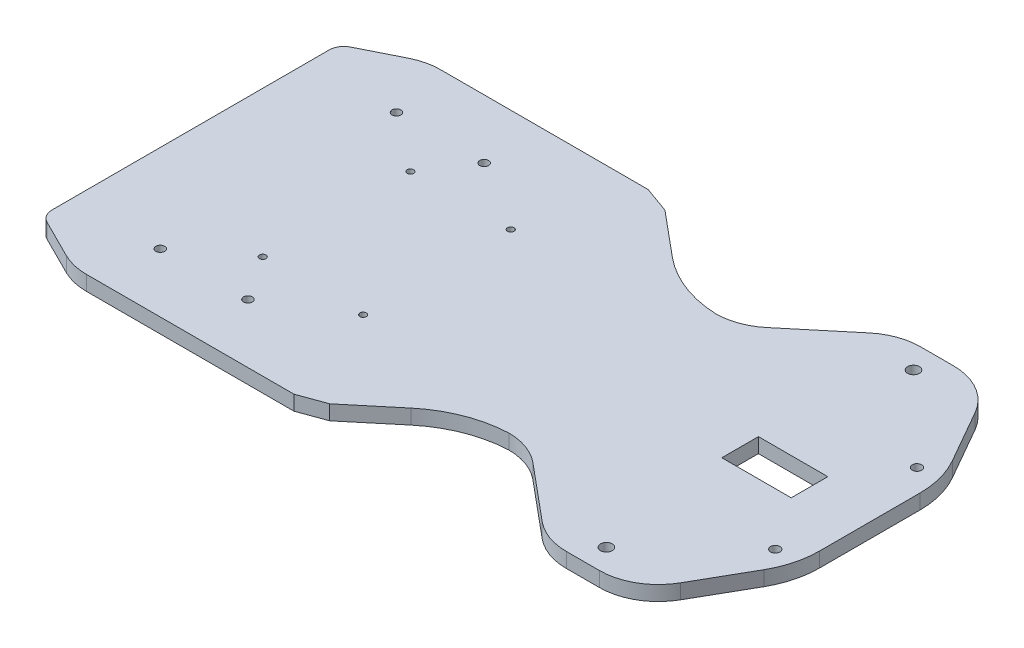
from build123d import *
from OCP.BRepFilletAPI import BRepFilletAPI_MakeChamfer

# Parameters (mm, degrees)
BOSS_EXTRUDE1_DEPTH   = 5
CHAMFER1_SIZE         = 5
CHAMFER1_SIZE2        = 5.047084744
FILLET4_R             = 20
F_4_0MM_DOWEL_HOLE1_D = 4
SKETCH5_R             = 2.75
CUT_EXTRUDE1_DEPTH    = 2
FILLET5_R             = 30
FILLET6_R             = 20
FILLET7_R             = 40
FILLET8_R             = 20
FILLET9_R             = 5
CUT_EXTRUDE3_REACH    = 154.398
SKETCH7_R             = 1.5
CUT_EXTRUDE4_REACH    = 154.398
SKETCH8_W             = 23.5
SKETCH8_H             = 12.4
CUT_EXTRUDE5_REACH    = 154.398
SKETCH9_R             = 1.1
CUT_EXTRUDE6_REACH    = 154.398
SKETCH11_R            = 1.6


with BuildPart() as part:
    # Sketch1 → Boss-Extrude1 (new body)
    with BuildSketch(Plane(origin=(0, 0, 0), x_dir=(1, 0, 0), z_dir=(0, 1, 0))):
        Polygon((40, 60), (70, 60), (90, 25), (90, -25), (70, -60), (40, -60), (10, -35), (-10, -35), (-40, -60), (-120, -60), (-140, -50), (-140, 50), (-120, 60), (-40, 60), (-10, 35), (10, 35), align=None)
    extrude(amount=BOSS_EXTRUDE1_DEPTH)

    # Chamfer1: one chamfer whose edges measure the first distance from different faces: ONE call of the kernel's chamfer builder (chamfer() names one face for all edges)
    chamfer1_edges_1 = [part.edges().sort_by_distance(p)[0] for p in [
        (-40, 2.5, 60),
    ]]
    chamfer1_side_1 = [part.faces().sort_by_distance(p)[0] for p in [
        (-80, 2.5, 60),
    ]]
    chamfer1_edges_2 = [part.edges().sort_by_distance(p)[0] for p in [
        (-40, 2.5, -60),
    ]]
    chamfer1_side_2 = [part.faces().sort_by_distance(p)[0] for p in [
        (-25, 2.5, -47.5),
    ]]
    chamfer1 = BRepFilletAPI_MakeChamfer(part.part.solid().wrapped)
    for e in chamfer1_edges_1:
        chamfer1.Add(CHAMFER1_SIZE, CHAMFER1_SIZE2, e.wrapped, chamfer1_side_1[0].wrapped)  # the first distance lies on this face
    for e in chamfer1_edges_2:
        chamfer1.Add(CHAMFER1_SIZE, CHAMFER1_SIZE2, e.wrapped, chamfer1_side_2[0].wrapped)  # the first distance lies on this face
    add(Compound.cast(chamfer1.Shape()), mode=Mode.REPLACE)

    # Fillet4
    fillet4_edges = [part.edges().sort_by_distance(p)[0] for p in [
        (40, 2.5, -60),
        (70, 2.5, -60),
        (70, 2.5, 60),
        (40, 2.5, 60),
    ]]
    fillet(fillet4_edges, radius=FILLET4_R)

    # Ø4.0mm Dowel Hole1 (through all)
    with Locations(Plane(origin=(52.817273997, 5, -52), x_dir=(0, 0, 1), z_dir=(0, 1, 0))):
        with Locations((0, 0), (104, 0)):
            Hole(F_4_0MM_DOWEL_HOLE1_D / 2)

    # Sketch5 → Cut-Extrude1 (cut)
    with BuildSketch(Plane.XZ):
        with Locations(Location((52.817273997, 52, 0), (0, 0, 270))):
            Circle(SKETCH5_R)
        with Locations(Location((52.817273997, -52, 0), (0, 0, 270))):
            Circle(SKETCH5_R)
    extrude(amount=-CUT_EXTRUDE1_DEPTH, mode=Mode.SUBTRACT)

    # Fillet5
    fillet5_edges = [part.edges().sort_by_distance(p)[0] for p in [
        (90, 2.5, -25),
        (90, 2.5, 25),
    ]]
    fillet(fillet5_edges, radius=FILLET5_R)

    # Fillet6
    fillet6_edges = [part.edges().sort_by_distance(p)[0] for p in [
        (10, 2.5, 35),
        (10, 2.5, -35),
    ]]
    fillet(fillet6_edges, radius=FILLET6_R)

    # Fillet7
    # the kernel refuses this fillet: 40 mm, written as the material it adds along each edge
    with BuildSketch(Plane(origin=(-10, 0, -35), x_dir=(-0.768221279597376, 0, -0.6401843996644798), z_dir=(0, 1, 0))) as fillet7_piece_1:
        with BuildLine():
            CenterArc((14.420794682, -40), FILLET7_R, 90, 37.26938559)
            Line((-9.801736302, -8.168113585), (0, 0))
            Line((0, 0), (14.420794682, 0))
        make_face()
    extrude(amount=5)
    with BuildSketch(Plane(origin=(-10, 0, 35), x_dir=(1, 0, 0), z_dir=(0, 1, 0))) as fillet7_piece_2:
        with BuildLine():
            CenterArc((14.529014643, -39.96081897), FILLET7_R, 92.536185502, 37.26938559)
            Line((-11.078361343, -9.231967786), (0, 0))
            Line((0, 0), (12.759001296, 0))
        make_face()
    extrude(amount=5)

    # Fillet8
    fillet8_edges = [part.edges().sort_by_distance(p)[0] for p in [
        (-120, 2.5, 60),
        (-120, 2.5, -60),
    ]]
    fillet(fillet8_edges, radius=FILLET8_R)

    # Fillet9
    fillet9_edges = [part.edges().sort_by_distance(p)[0] for p in [
        (-140, 2.5, 50),
        (-140, 2.5, -50),
    ]]
    fillet(fillet9_edges, radius=FILLET9_R)

    # Sketch7 → Cut-Extrude3 (cut, up to next)
    with BuildSketch(Plane(origin=(0, 5, 0), x_dir=(1, 0, 0), z_dir=(0, 1, 0)), mode=Mode.PRIVATE) as cut_extrude3_sk1:
        with Locations(Location((-110.27864045, 40, 0), (0, 0, 270))):
            Circle(SKETCH7_R)
    cut_extrude3_tool1 = extrude(cut_extrude3_sk1.sketch, amount=-CUT_EXTRUDE3_REACH, mode=Mode.PRIVATE) & part.part
    # Sketch7 → Cut-Extrude3 (cut, up to next)
    with BuildSketch(Plane(origin=(0, 5, 0), x_dir=(1, 0, 0), z_dir=(0, 1, 0)), mode=Mode.PRIVATE) as cut_extrude3_sk2:
        with Locations(Location((-80.57864045, 40, 0), (0, 0, 270))):
            Circle(SKETCH7_R)
    cut_extrude3_tool2 = extrude(cut_extrude3_sk2.sketch, amount=-CUT_EXTRUDE3_REACH, mode=Mode.PRIVATE) & part.part
    cut_extrude3_1 = cut_extrude3_tool1.solids().sort_by_distance((-110.27864, 5, -40))[0]
    add(cut_extrude3_1, mode=Mode.SUBTRACT)
    cut_extrude3_2 = cut_extrude3_tool2.solids().sort_by_distance((-80.57864, 5, -40))[0]
    add(cut_extrude3_2, mode=Mode.SUBTRACT)
    cut_extrude3 = cut_extrude3_1 + cut_extrude3_2  # Cut-Extrude3 as one shape, for the pattern or mirror that repeats it

    # Mirror1: Cut-Extrude3 across plane
    add(cut_extrude3.mirror(Plane.XY), mode=Mode.SUBTRACT)

    # Sketch8 → Cut-Extrude4 (cut, up to next)
    with BuildSketch(Plane(origin=(0, 5, 0), x_dir=(1, 0, 0), z_dir=(0, 1, 0)), mode=Mode.PRIVATE) as cut_extrude4_sk1:
        with Locations((57.85, 0)):
            Rectangle(SKETCH8_W, SKETCH8_H)
    cut_extrude4_tool1 = extrude(cut_extrude4_sk1.sketch, amount=-CUT_EXTRUDE4_REACH, mode=Mode.PRIVATE) & part.part
    add(cut_extrude4_tool1.solids().sort_by_distance((57.85, 5, 0))[0], mode=Mode.SUBTRACT)

    # Sketch9 → Cut-Extrude5 (cut, up to next)
    with BuildSketch(Plane(origin=(0, 5, 0), x_dir=(1, 0, 0), z_dir=(0, 1, 0)), mode=Mode.PRIVATE) as cut_extrude5_sk1:
        with Locations(Location((-90.57864045, 25, 0), (0, 0, 270))):
            Circle(SKETCH9_R)
    cut_extrude5_tool1 = extrude(cut_extrude5_sk1.sketch, amount=-CUT_EXTRUDE5_REACH, mode=Mode.PRIVATE) & part.part
    # Sketch9 → Cut-Extrude5 (cut, up to next)
    with BuildSketch(Plane(origin=(0, 5, 0), x_dir=(1, 0, 0), z_dir=(0, 1, 0)), mode=Mode.PRIVATE) as cut_extrude5_sk2:
        with Locations(Location((-56.57864045, 25, 0), (0, 0, 270))):
            Circle(SKETCH9_R)
    cut_extrude5_tool2 = extrude(cut_extrude5_sk2.sketch, amount=-CUT_EXTRUDE5_REACH, mode=Mode.PRIVATE) & part.part
    # Sketch9 → Cut-Extrude5 (cut, up to next)
    with BuildSketch(Plane(origin=(0, 5, 0), x_dir=(1, 0, 0), z_dir=(0, 1, 0)), mode=Mode.PRIVATE) as cut_extrude5_sk3:
        with Locations(Location((-90.57864045, -25, 0), (0, 0, 270))):
            Circle(SKETCH9_R)
    cut_extrude5_tool3 = extrude(cut_extrude5_sk3.sketch, amount=-CUT_EXTRUDE5_REACH, mode=Mode.PRIVATE) & part.part
    # Sketch9 → Cut-Extrude5 (cut, up to next)
    with BuildSketch(Plane(origin=(0, 5, 0), x_dir=(1, 0, 0), z_dir=(0, 1, 0)), mode=Mode.PRIVATE) as cut_extrude5_sk4:
        with Locations(Location((-56.57864045, -25, 0), (0, 0, 270))):
            Circle(SKETCH9_R)
    cut_extrude5_tool4 = extrude(cut_extrude5_sk4.sketch, amount=-CUT_EXTRUDE5_REACH, mode=Mode.PRIVATE) & part.part
    add(cut_extrude5_tool1.solids().sort_by_distance((-90.57864, 5, -25))[0], mode=Mode.SUBTRACT)
    add(cut_extrude5_tool2.solids().sort_by_distance((-56.57864, 5, -25))[0], mode=Mode.SUBTRACT)
    add(cut_extrude5_tool3.solids().sort_by_distance((-90.57864, 5, 25))[0], mode=Mode.SUBTRACT)
    add(cut_extrude5_tool4.solids().sort_by_distance((-56.57864, 5, 25))[0], mode=Mode.SUBTRACT)

    # Sketch11 → Cut-Extrude6 (cut, up to next)
    with BuildSketch(Plane(origin=(0, 5, 0), x_dir=(1, 0, 0), z_dir=(0, 1, 0)), mode=Mode.PRIVATE) as cut_extrude6_sk1:
        with Locations(Location((82, 24, 0), (0, 0, 270))):
            Circle(SKETCH11_R)
    cut_extrude6_tool1 = extrude(cut_extrude6_sk1.sketch, amount=-CUT_EXTRUDE6_REACH, mode=Mode.PRIVATE) & part.part
    # Sketch11 → Cut-Extrude6 (cut, up to next)
    with BuildSketch(Plane(origin=(0, 5, 0), x_dir=(1, 0, 0), z_dir=(0, 1, 0)), mode=Mode.PRIVATE) as cut_extrude6_sk2:
        with Locations(Location((82, -24, 0), (0, 0, 270))):
            Circle(SKETCH11_R)
    cut_extrude6_tool2 = extrude(cut_extrude6_sk2.sketch, amount=-CUT_EXTRUDE6_REACH, mode=Mode.PRIVATE) & part.part
    add(cut_extrude6_tool1.solids().sort_by_distance((82, 5, -24))[0], mode=Mode.SUBTRACT)
    add(cut_extrude6_tool2.solids().sort_by_distance((82, 5, 24))[0], mode=Mode.SUBTRACT)


solid = part.part
